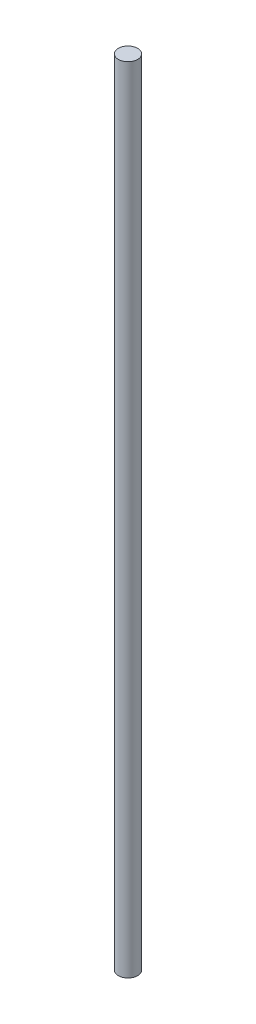
from build123d import *

# Parameters (mm, degrees)
SKETCH2_R           = 1.0795
BOSS_EXTRUDE1_DEPTH = 88.9


with BuildPart() as part:
    # Sketch2 → Boss-Extrude1 (new body)
    with BuildSketch(Plane(origin=(0, 0, 0), x_dir=(1, 0, 0), z_dir=(0, 1, 0))):
        Circle(SKETCH2_R)
    extrude(amount=BOSS_EXTRUDE1_DEPTH)


solid = part.part
